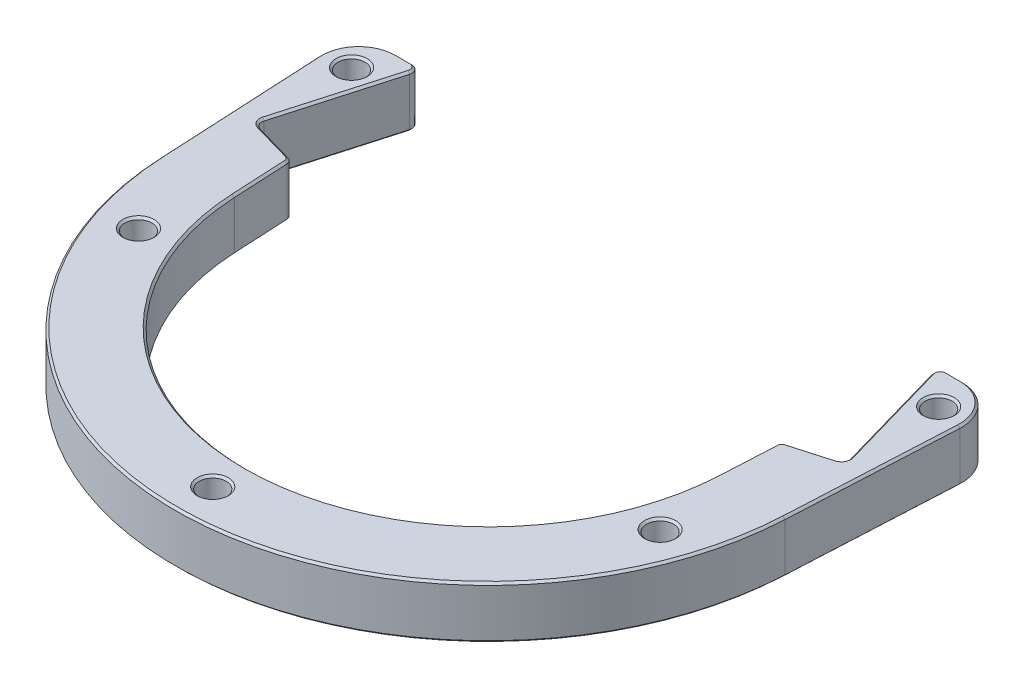
from build123d import *

# Parameters (mm, degrees)
BOSS_EXTRUDE1_DEPTH   = 6.35
M4X0_7_TAPPED_HOLE1_D = 3.3
MOVE_START            = -1.5452
MOVE_FACE1_DEPTH      = 6.35
FILLET1_R             = 0.762
CHAMFER1_SIZE         = 0.254


# Read off the part's stored shape, not the designer's step: Move Face1
with BuildPart() as part:
    # Sketch1 → Boss-Extrude1 (new body)
    with BuildSketch(Plane(origin=(0, -1.5452, 0), x_dir=(1, 0, 0), z_dir=(0, 1, 0))):
        with BuildLine():
            Line((-38.502216327, 6.405933187), (-37.466084693, -13.910736196))
            ThreePointArc((-37.466084693, -13.910736196), (0, -49.514775956), (37.466084693, -13.910736196))
            Line((37.466084693, -13.910736196), (38.502216327, 6.405933187))
            ThreePointArc((38.502216327, 6.405933187), (37.384487444, 9.425866669), (34.42540277, 10.695958786))
            Line((34.42540277, 10.695958786), (32.657493289, 10.695958786))
            ThreePointArc((32.657493289, 10.695958786), (32.454748459, 10.594968738), (32.41333978, 10.372281116))
            Line((32.41333978, 10.372281116), (36.356433895, -3.429162442))
            ThreePointArc((36.356433895, -3.429162442), (36.223319367, -4.587824739), (35.309857101, -5.312948512))
            Line((35.309857101, -5.312948512), (30.453700202, -6.70036017))
            Line((30.453700202, -6.70036017), (30.10512277, -13.535333842))
            ThreePointArc((30.10512277, -13.535333842), (0, -42.14424766), (-30.10512277, -13.535333842))
            Line((-30.10512277, -13.535333842), (-30.453700202, -6.70036017))
            Line((-30.453700202, -6.70036017), (-35.309857101, -5.312948512))
            ThreePointArc((-35.309857101, -5.312948512), (-36.223319367, -4.587824739), (-36.356433895, -3.429162442))
            Line((-36.356433895, -3.429162442), (-32.41333978, 10.372281116))
            ThreePointArc((-32.41333978, 10.372281116), (-32.454748459, 10.594968738), (-32.657493289, 10.695958786))
            Line((-32.657493289, 10.695958786), (-34.42540277, 10.695958786))
            ThreePointArc((-34.42540277, 10.695958786), (-37.384487444, 9.425866669), (-38.502216327, 6.405933187))
        make_face()
    extrude(amount=BOSS_EXTRUDE1_DEPTH)

    # M4x0.7 Tapped Hole1 (through all)
    with Locations(Plane(origin=(0, -1.5452, 0), x_dir=(-1, 0, 0), z_dir=(0, -1, 0))):
        with Locations((31.804908667, -22.86), (35.794080898, 7.112), (0, -45.607912987), (-31.804908667, -22.86), (-35.794080898, 7.112)):
            Hole(M4X0_7_TAPPED_HOLE1_D / 2)

    # Move Face1 outline → Move Face1 (add)
    with BuildSketch(Plane(origin=(0, 0, 0), x_dir=(1, 0, 0), z_dir=(0, 1, 0)).offset(MOVE_START)):
        with BuildLine():
            ThreePointArc((-34.42540277, 11.330958786), (-37.844793004, 9.863295282), (-39.136392147, 6.373590798))
            Line((-39.136392147, 6.373590798), (-38.100260512, -13.943078585))
            ThreePointArc((-38.100260512, -13.943078585), (0, -50.149775956), (38.100260512, -13.943078585))
            Line((38.100260512, -13.943078585), (39.136392147, 6.373590798))
            ThreePointArc((39.136392147, 6.373590798), (37.844793004, 9.863295282), (34.42540277, 11.330958786))
            Line((34.42540277, 11.330958786), (32.657662642, 11.330958764))
            ThreePointArc((32.657662642, 11.330958764), (31.94785031, 10.977433467), (31.802770017, 10.197840375))
            Line((31.802770017, 10.197840375), (35.745873307, -3.603635272))
            ThreePointArc((35.745873307, -3.603635272), (35.668225017, -4.27944954), (35.135416361, -4.702378753))
            Line((35.135416361, -4.702378753), (29.842651852, -6.214529893))
            Line((29.842651852, -6.214529893), (29.47094695, -13.502991453))
            ThreePointArc((29.47094695, -13.502991453), (0, -41.50924766), (-29.47094695, -13.502991453))
            Line((-29.47094695, -13.502991453), (-29.842651852, -6.214529893))
            Line((-29.842651852, -6.214529893), (-35.135448453, -4.702369587))
            ThreePointArc((-35.135448453, -4.702369587), (-35.668241226, -4.279420366), (-35.745864137, -3.603603182))
            Line((-35.745864137, -3.603603182), (-31.802816567, 10.197677545))
            ThreePointArc((-31.802816567, 10.197677545), (-31.947748326, 10.977298265), (-32.657493289, 11.330958793))
            Line((-32.657493289, 11.330958793), (-34.42540277, 11.330958786))
        make_face()
        with BuildLine():
            Line((-37.466084693, -13.910736196), (-38.502216327, 6.405933187))
            ThreePointArc((-38.502216327, 6.405933187), (-37.384487444, 9.425866669), (-34.42540277, 10.695958786))
            Line((-34.42540277, 10.695958786), (-32.657493289, 10.695958786))
            ThreePointArc((-32.657493289, 10.695958786), (-32.454748459, 10.594968738), (-32.41333978, 10.372281116))
            Line((-32.41333978, 10.372281116), (-36.356433895, -3.429162442))
            ThreePointArc((-36.356433895, -3.429162442), (-36.223319367, -4.587824739), (-35.309857101, -5.312948512))
            Line((-35.309857101, -5.312948512), (-30.453700202, -6.70036017))
            Line((-30.453700202, -6.70036017), (-30.10512277, -13.535333842))
            ThreePointArc((-30.10512277, -13.535333842), (0, -42.14424766), (30.10512277, -13.535333842))
            Line((30.10512277, -13.535333842), (30.453700202, -6.70036017))
            Line((30.453700202, -6.70036017), (35.309857101, -5.312948512))
            ThreePointArc((35.309857101, -5.312948512), (36.223319367, -4.587824739), (36.356433895, -3.429162442))
            Line((36.356433895, -3.429162442), (32.41333978, 10.372281116))
            ThreePointArc((32.41333978, 10.372281116), (32.454748459, 10.594968738), (32.657493289, 10.695958786))
            Line((32.657493289, 10.695958786), (34.42540277, 10.695958786))
            ThreePointArc((34.42540277, 10.695958786), (37.384487444, 9.425866669), (38.502216327, 6.405933187))
            Line((38.502216327, 6.405933187), (37.466084693, -13.910736196))
            ThreePointArc((37.466084693, -13.910736196), (0, -49.514775956), (-37.466084693, -13.910736196))
        make_face(mode=Mode.SUBTRACT)
    extrude(amount=MOVE_FACE1_DEPTH)

    # Fillet1
    fillet1_edges = [part.edges().sort_by_distance(p)[0] for p in [
        (-29.842651852, 1.6298, 6.214529893),
        (29.842651852, 1.6298, 6.214529893),
    ]]
    fillet(fillet1_edges, radius=FILLET1_R)

    # Chamfer1
    chamfer1_edges = [part.edges().sort_by_distance(p)[0] for p in [
        (0, 4.8048, 50.149775956),
        (38.61832633, 4.8048, 3.784743893),
        (-33.54144803, -1.5452, -11.33095879),
        (37.844793004, 4.8048, -9.863295282),
        (-31.947748326, -1.5452, -10.977298265),
        (-33.774340352, -1.5452, -3.297037181),
        (-35.668241226, -1.5452, 4.279420366),
        (-29.642922919, -1.5452, 10.130853406),
        (0, -1.5452, 41.50924766),
        (32.750998673, -1.5452, 5.383610635),
        (33.541532706, 4.8048, -11.330958775),
        (35.668225017, -1.5452, 4.27944954),
        (33.774321662, -1.5452, -3.297102552),
        (31.94785031, -1.5452, -10.977433467),
        (33.541532706, -1.5452, -11.330958775),
        (37.844793004, -1.5452, -9.863295282),
        (38.61832633, -1.5452, 3.784743893),
        (0, -1.5452, 50.149775956),
        (31.94785031, 4.8048, -10.977433467),
        (-38.61832633, -1.5452, 3.784743893),
        (-37.844793004, -1.5452, -9.863295282),
        (33.774321662, 4.8048, -3.297102552),
        (35.668225017, 4.8048, 4.27944954),
        (32.750998673, 4.8048, 5.383610635),
        (0, 4.8048, 41.50924766),
        (-37.844793004, 4.8048, -9.863295282),
        (-29.642922919, 4.8048, 10.130853406),
        (-35.668241226, 4.8048, 4.279420366),
        (-33.774340352, 4.8048, -3.297037181),
        (-31.947748326, 4.8048, -10.977298265),
        (34.144080898, -1.5452, -7.112),
        (34.144080898, 4.8048, -7.112),
        (-33.54144803, 4.8048, -11.33095879),
        (30.154908667, -1.5452, 22.86),
        (30.154908667, 4.8048, 22.86),
        (-1.65, -1.5452, 45.607912987),
        (-1.65, 4.8048, 45.607912987),
        (-37.444080898, -1.5452, -7.112),
        (-37.444080898, 4.8048, -7.112),
        (-38.61832633, 4.8048, 3.784743893),
        (-33.454908667, -1.5452, 22.86),
        (-33.454908667, 4.8048, 22.86),
        (-32.751014719, -1.5452, 5.383606052),
        (-32.751014719, 4.8048, 5.383606052),
        (29.642922919, -1.5452, 10.130853405),
        (29.979458075, -1.5452, 6.323301327),
        (-29.979458075, -1.5452, 6.323301327),
        (29.642922919, 4.8048, 10.130853405),
        (29.979458075, 4.8048, 6.323301327),
        (-29.979458075, 4.8048, 6.323301327),
    ]]
    chamfer(chamfer1_edges, length=CHAMFER1_SIZE)


solid = part.part
